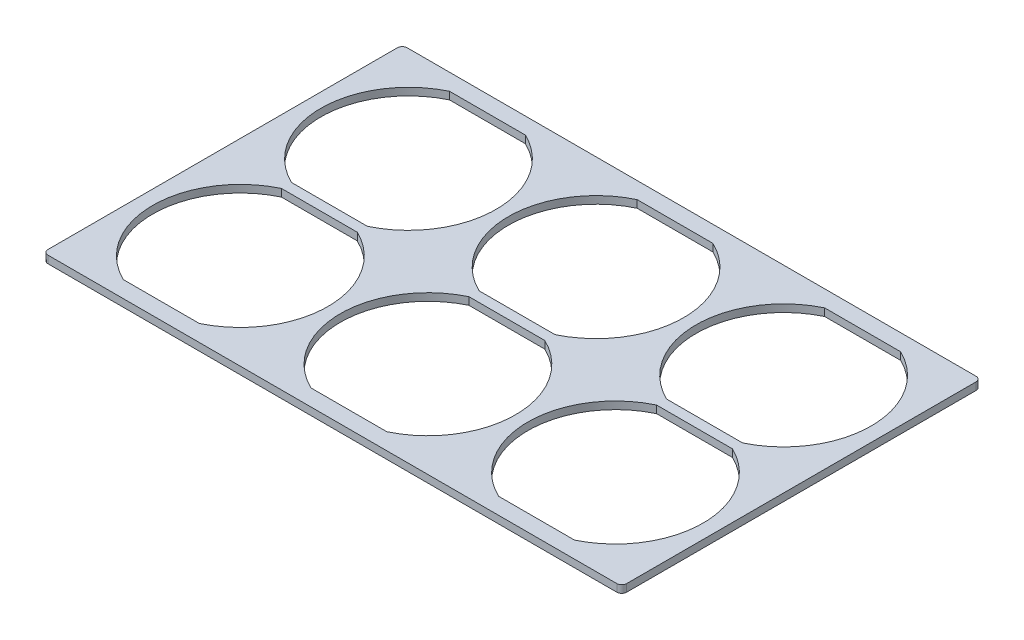
from build123d import *

# Parameters (mm, degrees)
BOSS_EXTRUDE1_DEPTH = 4.7752


with BuildPart() as part:
    # Sketch1 → Boss-Extrude1 (new body)
    with BuildSketch(Plane(origin=(0, 0, 0), x_dir=(1, 0, 0), z_dir=(0, 1, 0))):
        with BuildLine():
            Line((-180.975, 114.3), (180.975, 114.3))
            ThreePointArc((180.975, 114.3), (183.22006403, 113.37006403), (184.15, 111.125))
            Line((184.15, 111.125), (184.15, -111.125))
            ThreePointArc((184.15, -111.125), (183.22006403, -113.37006403), (180.975, -114.3))
            Line((180.975, -114.3), (-180.975, -114.3))
            ThreePointArc((-180.975, -114.3), (-183.22006403, -113.37006403), (-184.15, -111.125))
            Line((-184.15, -111.125), (-184.15, 111.125))
            ThreePointArc((-184.15, 111.125), (-183.22006403, 113.37006403), (-180.975, 114.3))
        make_face()
        with BuildLine():
            Line((-24.1554, -3.2385), (24.1554, -3.2385))
            ThreePointArc((24.1554, -3.2385), (55.767194164, -53.5178), (24.1554, -103.7971))
            Line((24.1554, -103.7971), (-24.1554, -103.7971))
            ThreePointArc((-24.1554, -103.7971), (-55.767194164, -53.5178), (-24.1554, -3.2385))
        make_face(mode=Mode.SUBTRACT)
        with BuildLine():
            Line((95.2246, -3.2385), (143.5354, -3.2385))
            ThreePointArc((143.5354, -3.2385), (175.147194164, -53.5178), (143.5354, -103.7971))
            Line((143.5354, -103.7971), (95.2246, -103.7971))
            ThreePointArc((95.2246, -103.7971), (63.612805836, -53.5178), (95.2246, -3.2385))
        make_face(mode=Mode.SUBTRACT)
        with BuildLine():
            Line((-143.5354, -3.2385), (-95.2246, -3.2385))
            ThreePointArc((-95.2246, -3.2385), (-63.612805836, -53.5178), (-95.2246, -103.7971))
            Line((-95.2246, -103.7971), (-143.5354, -103.7971))
            ThreePointArc((-143.5354, -103.7971), (-175.147194164, -53.5178), (-143.5354, -3.2385))
        make_face(mode=Mode.SUBTRACT)
        with BuildLine():
            Line((-24.179305836, 103.7971), (24.131494164, 103.7971))
            ThreePointArc((24.131494164, 103.7971), (55.743288328, 53.5178), (24.131494164, 3.2385))
            Line((24.131494164, 3.2385), (-24.179305836, 3.2385))
            ThreePointArc((-24.179305836, 3.2385), (-55.7911, 53.5178), (-24.179305836, 103.7971))
        make_face(mode=Mode.SUBTRACT)
        with BuildLine():
            Line((-143.559305836, 103.7971), (-95.248505836, 103.7971))
            ThreePointArc((-95.248505836, 103.7971), (-63.636711672, 53.5178), (-95.248505836, 3.2385))
            Line((-95.248505836, 3.2385), (-143.559305836, 3.2385))
            ThreePointArc((-143.559305836, 3.2385), (-175.1711, 53.5178), (-143.559305836, 103.7971))
        make_face(mode=Mode.SUBTRACT)
        with BuildLine():
            Line((95.200694164, 103.7971), (143.511494164, 103.7971))
            ThreePointArc((143.511494164, 103.7971), (175.123288328, 53.5178), (143.511494164, 3.2385))
            Line((143.511494164, 3.2385), (95.200694164, 3.2385))
            ThreePointArc((95.200694164, 3.2385), (63.5889, 53.5178), (95.200694164, 103.7971))
        make_face(mode=Mode.SUBTRACT)
    extrude(amount=BOSS_EXTRUDE1_DEPTH)


solid = part.part
